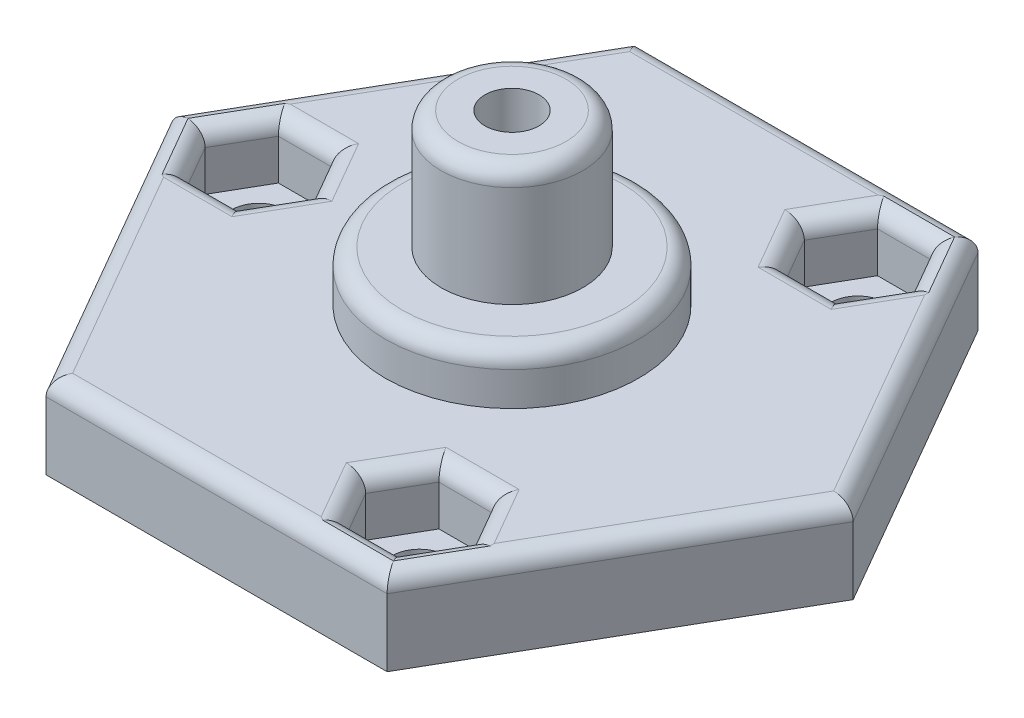
from build123d import *

# Parameters (mm, degrees)
ESQUISSE1_R             = 1.6
BOSS_EXTRU_1_DEPTH      = 5
ENL_V_MAT_EXTRU_1_DEPTH = 3.4
ESQUISSE5_R             = 7.5
BOSS_EXTRU_3_DEPTH      = 3
ESQUISSE4_R             = 4.2
BOSS_EXTRU_2_DEPTH      = 7
CONG_1_R                = 1
ESQUISSE7_R             = 1.6
ENL_V_MAT_EXTRU_2_DEPTH = 31.652623596
ENL_V_MAT_EXTRU_3_DEPTH = 5


with BuildPart() as part:
    # Esquisse1 → Boss.-Extru.1 (new body)
    with BuildSketch(Plane(origin=(0, 0, 0), x_dir=(1, 0, 0), z_dir=(0, 1, 0))):
        Polygon((10.103629711, 17.5), (-10.103629711, 17.5), (-20.207259422, 0), (-10.103629711, -17.5), (10.103629711, -17.5), (20.207259422, 0), align=None)
        with Locations(Location((-15, 0, 0), (0, 0, 270))):
            Circle(ESQUISSE1_R, mode=Mode.SUBTRACT)
        with Locations(Location((7.5, 12.990381057, 0), (0, 0, 270))):
            Circle(ESQUISSE1_R, mode=Mode.SUBTRACT)
        with Locations(Location((7.5, -12.990381057, 0), (0, 0, 270))):
            Circle(ESQUISSE1_R, mode=Mode.SUBTRACT)
    extrude(amount=BOSS_EXTRU_1_DEPTH)

    # Esquisse3 → Enlèv. mat.-Extru.1 (cut)
    with BuildSketch(Plane(origin=(0, 5, 0), x_dir=(1, 0, 0), z_dir=(0, 1, 0))):
        Polygon((-13.41228676, 2.75), (-16.58771324, 2.75), (-18.175426481, 0), (-16.58771324, -2.75), (-13.41228676, -2.75), (-11.824573519, 0), align=None)
        Polygon((9.08771324, 10.240381057), (10.675426481, 12.990381057), (9.08771324, 15.740381057), (5.91228676, 15.740381057), (4.324573519, 12.990381057), (5.91228676, 10.240381057), align=None)
        Polygon((9.08771324, -10.240381057), (5.91228676, -10.240381057), (4.324573519, -12.990381057), (5.91228676, -15.740381057), (9.08771324, -15.740381057), (10.675426481, -12.990381057), align=None)
    extrude(amount=-ENL_V_MAT_EXTRU_1_DEPTH, mode=Mode.SUBTRACT)

    # Esquisse5 → Boss.-Extru.3 (add)
    with BuildSketch(Plane(origin=(0, 5, 0), x_dir=(1, 0, 0), z_dir=(0, 1, 0))):
        with Locations(Location((0, 0, 0), (0, 0, 270))):
            Circle(ESQUISSE5_R)
    extrude(amount=BOSS_EXTRU_3_DEPTH)

    # Esquisse4 → Boss.-Extru.2 (add)
    with BuildSketch(Plane(origin=(0, 8, 0), x_dir=(1, 0, 0), z_dir=(0, 1, 0))):
        with Locations(Location((0, 0, 0), (0, 0, 270))):
            Circle(ESQUISSE4_R)
    extrude(amount=BOSS_EXTRU_2_DEPTH)

    # Congé1
    # the kernel refuses this fillet: 1 mm, written as the material it takes off along each edge
    with BuildSketch(Plane(origin=(-8.853629711, 5, -19.665063509), x_dir=(0, -1, 0), z_dir=(-0.5000000000000002, 0, 0.8660254037844386)), Plane(origin=(21.457259422, 5, 2.165063509), x_dir=(0, -1, 0), z_dir=(-0.5000000000000003, 0, -0.8660254037844386)), Plane(origin=(12.603629711, 5, -17.5), x_dir=(0, -1, 0), z_dir=(-1, 0, 0))) as cong_1_piece_1:
        with BuildLine():
            CenterArc((CONG_1_R, CONG_1_R), CONG_1_R, 180, 90)
            Line((0, CONG_1_R), (0, 0))
            Line((0, 0), (CONG_1_R, 0))
        make_face()
    extrude(amount=25.207259422, mode=Mode.SUBTRACT)
    with BuildSketch(Plane(origin=(-21.457259422, 5, -2.165063509), x_dir=(0.8660254037844386, 0, -0.5000000000000002), z_dir=(0.5000000000000002, 0, 0.8660254037844386)), Plane(origin=(-12.603629711, 5, 17.5), x_dir=(0, 0, -1), z_dir=(1, 0, 0)), Plane(origin=(8.853629711, 5, 19.665063509), x_dir=(-0.8660254037844386, 0, -0.5000000000000001), z_dir=(0.5000000000000001, 0, -0.8660254037844386))) as cong_1_piece_2:
        with BuildLine():
            CenterArc((CONG_1_R, -CONG_1_R), CONG_1_R, 90, 90)
            Line((0, -CONG_1_R), (0, 0))
            Line((0, 0), (CONG_1_R, 0))
        make_face()
    extrude(amount=25.207259422, mode=Mode.SUBTRACT)
    with BuildSketch(Plane(origin=(-10.574573519, 5, 2.165063509), x_dir=(0.866025403784438, 0, -0.500000000000001), z_dir=(-0.500000000000001, 0, -0.8660254037844382))) as cong_1_piece_3_section:
        with BuildLine():
            CenterArc((CONG_1_R, CONG_1_R), CONG_1_R, 180, 90)
            Line((0, CONG_1_R), (0, 0))
            Line((0, 0), (CONG_1_R, 0))
        make_face()
    cong_1_piece_3 = extrude(amount=8.175426481, mode=Mode.PRIVATE)
    cong_1_piece_3 = split(cong_1_piece_3, bisect_by=Plane(origin=(-12.438315605, 4.76272493, -2.75), z_dir=(0, 0, 1)), keep=Keep.TOP, mode=Mode.PRIVATE)
    cong_1_piece_3 = split(cong_1_piece_3, bisect_by=Plane(origin=(-11.337587942, 4.76272493, -0.843483763), z_dir=(-0.8660254037844386, 0, -0.5000000000000002)), keep=Keep.TOP, mode=Mode.PRIVATE)
    add(cong_1_piece_3, mode=Mode.SUBTRACT)
    with BuildSketch(Plane(origin=(-10.91228676, 5, -2.75), x_dir=(0, 0, -1), z_dir=(-1, 0, 0))) as cong_1_piece_4_section:
        with BuildLine():
            CenterArc((CONG_1_R, CONG_1_R), CONG_1_R, 180, 90)
            Line((0, CONG_1_R), (0, 0))
            Line((0, 0), (CONG_1_R, 0))
        make_face()
    cong_1_piece_4 = extrude(amount=8.175426481, mode=Mode.PRIVATE)
    cong_1_piece_4 = split(cong_1_piece_4, bisect_by=Plane(origin=(-13.899272337, 4.76272493, -3.593483763), z_dir=(-0.8660254037844382, 0, 0.500000000000001)), keep=Keep.TOP, mode=Mode.PRIVATE)
    cong_1_piece_4 = split(cong_1_piece_4, bisect_by=Plane(origin=(-16.100727663, 4.76272493, -3.593483763), z_dir=(0.8660254037844394, 0, 0.49999999999999883)), keep=Keep.TOP, mode=Mode.PRIVATE)
    add(cong_1_piece_4, mode=Mode.SUBTRACT)
    with BuildSketch(Plane(origin=(-15.33771324, 5, -4.915063509), x_dir=(-0.8660254037844393, 0, -0.49999999999999883), z_dir=(-0.49999999999999883, 0, 0.8660254037844394))) as cong_1_piece_5_section:
        with BuildLine():
            CenterArc((CONG_1_R, CONG_1_R), CONG_1_R, 180, 90)
            Line((0, CONG_1_R), (0, 0))
            Line((0, 0), (CONG_1_R, 0))
        make_face()
    cong_1_piece_5 = extrude(amount=8.175426481, mode=Mode.PRIVATE)
    cong_1_piece_5 = split(cong_1_piece_5, bisect_by=Plane(origin=(-17.561684395, 4.76272493, -2.75), z_dir=(0, 0, 1)), keep=Keep.TOP, mode=Mode.PRIVATE)
    cong_1_piece_5 = split(cong_1_piece_5, bisect_by=Plane(origin=(-18.662412058, 4.76272493, -0.843483763), z_dir=(0.8660254037844384, 0, -0.5000000000000006)), keep=Keep.TOP, mode=Mode.PRIVATE)
    add(cong_1_piece_5, mode=Mode.SUBTRACT)
    with BuildSketch(Plane(origin=(-19.425426481, 5, -2.165063509), x_dir=(-0.8660254037844384, 0, 0.5000000000000006), z_dir=(0.5000000000000006, 0, 0.8660254037844384))) as cong_1_piece_6_section:
        with BuildLine():
            CenterArc((CONG_1_R, CONG_1_R), CONG_1_R, 180, 90)
            Line((0, CONG_1_R), (0, 0))
            Line((0, 0), (CONG_1_R, 0))
        make_face()
    cong_1_piece_6 = extrude(amount=8.175426481, mode=Mode.PRIVATE)
    cong_1_piece_6 = split(cong_1_piece_6, bisect_by=Plane(origin=(-18.662412058, 4.76272493, 0.843483763), z_dir=(0.8660254037844394, 0, 0.49999999999999883)), keep=Keep.TOP, mode=Mode.PRIVATE)
    cong_1_piece_6 = split(cong_1_piece_6, bisect_by=Plane(origin=(-17.561684395, 4.76272493, 2.75), z_dir=(0, 0, -1)), keep=Keep.TOP, mode=Mode.PRIVATE)
    add(cong_1_piece_6, mode=Mode.SUBTRACT)
    with BuildSketch(Plane(origin=(-19.08771324, 5, 2.75), x_dir=(0, 0, 1), z_dir=(1, 0, 0))) as cong_1_piece_7_section:
        with BuildLine():
            CenterArc((CONG_1_R, CONG_1_R), CONG_1_R, 180, 90)
            Line((0, CONG_1_R), (0, 0))
            Line((0, 0), (CONG_1_R, 0))
        make_face()
    cong_1_piece_7 = extrude(amount=8.175426481, mode=Mode.PRIVATE)
    cong_1_piece_7 = split(cong_1_piece_7, bisect_by=Plane(origin=(-13.899272337, 4.76272493, 3.593483763), z_dir=(-0.8660254037844386, 0, -0.5000000000000002)), keep=Keep.TOP, mode=Mode.PRIVATE)
    cong_1_piece_7 = split(cong_1_piece_7, bisect_by=Plane(origin=(-16.100727663, 4.76272493, 3.593483763), z_dir=(0.8660254037844384, 0, -0.5000000000000006)), keep=Keep.TOP, mode=Mode.PRIVATE)
    add(cong_1_piece_7, mode=Mode.SUBTRACT)
    with BuildSketch(Plane(origin=(-14.66228676, 5, 4.915063509), x_dir=(0.8660254037844387, 0, 0.5000000000000002), z_dir=(0.5000000000000002, 0, -0.8660254037844386))) as cong_1_piece_8_section:
        with BuildLine():
            CenterArc((CONG_1_R, CONG_1_R), CONG_1_R, 180, 90)
            Line((0, CONG_1_R), (0, 0))
            Line((0, 0), (CONG_1_R, 0))
        make_face()
    cong_1_piece_8 = extrude(amount=8.175426481, mode=Mode.PRIVATE)
    cong_1_piece_8 = split(cong_1_piece_8, bisect_by=Plane(origin=(-11.337587942, 4.76272493, 0.843483763), z_dir=(-0.8660254037844382, 0, 0.500000000000001)), keep=Keep.TOP, mode=Mode.PRIVATE)
    cong_1_piece_8 = split(cong_1_piece_8, bisect_by=Plane(origin=(-12.438315605, 4.76272493, 2.75), z_dir=(0, 0, -1)), keep=Keep.TOP, mode=Mode.PRIVATE)
    add(cong_1_piece_8, mode=Mode.SUBTRACT)
    with BuildSketch(Plane(origin=(3.41228676, 5, -10.240381057), x_dir=(0, 0, 1), z_dir=(1, 0, 0))) as cong_1_piece_9_section:
        with BuildLine():
            CenterArc((CONG_1_R, CONG_1_R), CONG_1_R, 180, 90)
            Line((0, CONG_1_R), (0, 0))
            Line((0, 0), (CONG_1_R, 0))
        make_face()
    cong_1_piece_9 = extrude(amount=8.175426481, mode=Mode.PRIVATE)
    cong_1_piece_9 = split(cong_1_piece_9, bisect_by=Plane(origin=(8.600727663, 4.76272493, -9.396897294), z_dir=(-0.8660254037844385, 0, -0.5000000000000003)), keep=Keep.TOP, mode=Mode.PRIVATE)
    cong_1_piece_9 = split(cong_1_piece_9, bisect_by=Plane(origin=(6.399272337, 4.76272493, -9.396897294), z_dir=(0.866025403784439, 0, -0.4999999999999995)), keep=Keep.TOP, mode=Mode.PRIVATE)
    add(cong_1_piece_9, mode=Mode.SUBTRACT)
    with BuildSketch(Plane(origin=(7.83771324, 5, -8.075317547), x_dir=(0.8660254037844385, 0, 0.5000000000000003), z_dir=(0.5000000000000003, 0, -0.8660254037844385))) as cong_1_piece_10_section:
        with BuildLine():
            CenterArc((CONG_1_R, CONG_1_R), CONG_1_R, 180, 90)
            Line((0, CONG_1_R), (0, 0))
            Line((0, 0), (CONG_1_R, 0))
        make_face()
    cong_1_piece_10 = extrude(amount=8.175426481, mode=Mode.PRIVATE)
    cong_1_piece_10 = split(cong_1_piece_10, bisect_by=Plane(origin=(10.061684395, 4.76272493, -10.240381057), z_dir=(0, 0, -1)), keep=Keep.TOP, mode=Mode.PRIVATE)
    cong_1_piece_10 = split(cong_1_piece_10, bisect_by=Plane(origin=(11.162412058, 4.76272493, -12.146897294), z_dir=(-0.8660254037844394, 0, 0.4999999999999987)), keep=Keep.TOP, mode=Mode.PRIVATE)
    add(cong_1_piece_10, mode=Mode.SUBTRACT)
    with BuildSketch(Plane(origin=(11.925426481, 5, -10.825317547), x_dir=(0.8660254037844394, 0, -0.4999999999999988), z_dir=(-0.4999999999999987, 0, -0.8660254037844394))) as cong_1_piece_11_section:
        with BuildLine():
            CenterArc((CONG_1_R, CONG_1_R), CONG_1_R, 180, 90)
            Line((0, CONG_1_R), (0, 0))
            Line((0, 0), (CONG_1_R, 0))
        make_face()
    cong_1_piece_11 = extrude(amount=8.175426481, mode=Mode.PRIVATE)
    cong_1_piece_11 = split(cong_1_piece_11, bisect_by=Plane(origin=(11.162412058, 4.76272493, -13.833864819), z_dir=(-0.8660254037844385, 0, -0.5000000000000003)), keep=Keep.TOP, mode=Mode.PRIVATE)
    cong_1_piece_11 = split(cong_1_piece_11, bisect_by=Plane(origin=(10.061684395, 4.76272493, -15.740381057), z_dir=(0, 0, 1)), keep=Keep.TOP, mode=Mode.PRIVATE)
    add(cong_1_piece_11, mode=Mode.SUBTRACT)
    with BuildSketch(Plane(origin=(11.58771324, 5, -15.740381057), x_dir=(0, 0, -1), z_dir=(-1, 0, 0))) as cong_1_piece_12_section:
        with BuildLine():
            CenterArc((CONG_1_R, CONG_1_R), CONG_1_R, 180, 90)
            Line((0, CONG_1_R), (0, 0))
            Line((0, 0), (CONG_1_R, 0))
        make_face()
    cong_1_piece_12 = extrude(amount=8.175426481, mode=Mode.PRIVATE)
    cong_1_piece_12 = split(cong_1_piece_12, bisect_by=Plane(origin=(8.600727663, 4.76272493, -16.583864819), z_dir=(-0.8660254037844394, 0, 0.4999999999999987)), keep=Keep.TOP, mode=Mode.PRIVATE)
    cong_1_piece_12 = split(cong_1_piece_12, bisect_by=Plane(origin=(6.399272337, 4.76272493, -16.583864819), z_dir=(0.8660254037844387, 0, 0.5)), keep=Keep.TOP, mode=Mode.PRIVATE)
    add(cong_1_piece_12, mode=Mode.SUBTRACT)
    with BuildSketch(Plane(origin=(7.16228676, 5, -17.905444566), x_dir=(-0.8660254037844387, 0, -0.49999999999999994), z_dir=(-0.5, 0, 0.8660254037844387))) as cong_1_piece_13_section:
        with BuildLine():
            CenterArc((CONG_1_R, CONG_1_R), CONG_1_R, 180, 90)
            Line((0, CONG_1_R), (0, 0))
            Line((0, 0), (CONG_1_R, 0))
        make_face()
    cong_1_piece_13 = extrude(amount=8.175426481, mode=Mode.PRIVATE)
    cong_1_piece_13 = split(cong_1_piece_13, bisect_by=Plane(origin=(3.837587942, 4.76272493, -13.833864819), z_dir=(0.866025403784439, 0, -0.4999999999999995)), keep=Keep.TOP, mode=Mode.PRIVATE)
    cong_1_piece_13 = split(cong_1_piece_13, bisect_by=Plane(origin=(4.938315605, 4.76272493, -15.740381057), z_dir=(0, 0, 1)), keep=Keep.TOP, mode=Mode.PRIVATE)
    add(cong_1_piece_13, mode=Mode.SUBTRACT)
    with BuildSketch(Plane(origin=(3.074573519, 5, -15.155444566), x_dir=(-0.866025403784439, 0, 0.4999999999999995), z_dir=(0.4999999999999995, 0, 0.866025403784439))) as cong_1_piece_14_section:
        with BuildLine():
            CenterArc((CONG_1_R, CONG_1_R), CONG_1_R, 180, 90)
            Line((0, CONG_1_R), (0, 0))
            Line((0, 0), (CONG_1_R, 0))
        make_face()
    cong_1_piece_14 = extrude(amount=8.175426481, mode=Mode.PRIVATE)
    cong_1_piece_14 = split(cong_1_piece_14, bisect_by=Plane(origin=(4.938315605, 4.76272493, -10.240381057), z_dir=(0, 0, -1)), keep=Keep.TOP, mode=Mode.PRIVATE)
    cong_1_piece_14 = split(cong_1_piece_14, bisect_by=Plane(origin=(3.837587942, 4.76272493, -12.146897294), z_dir=(0.8660254037844387, 0, 0.5)), keep=Keep.TOP, mode=Mode.PRIVATE)
    add(cong_1_piece_14, mode=Mode.SUBTRACT)
    with BuildSketch(Plane(origin=(11.925426481, 5, 15.155444566), x_dir=(0.8660254037844385, 0, -0.5000000000000003), z_dir=(-0.5000000000000003, 0, -0.8660254037844385))) as cong_1_piece_15_section:
        with BuildLine():
            CenterArc((CONG_1_R, CONG_1_R), CONG_1_R, 180, 90)
            Line((0, CONG_1_R), (0, 0))
            Line((0, 0), (CONG_1_R, 0))
        make_face()
    cong_1_piece_15 = extrude(amount=8.175426481, mode=Mode.PRIVATE)
    cong_1_piece_15 = split(cong_1_piece_15, bisect_by=Plane(origin=(10.061684395, 4.76272493, 10.240381057), z_dir=(0, 0, 1)), keep=Keep.TOP, mode=Mode.PRIVATE)
    cong_1_piece_15 = split(cong_1_piece_15, bisect_by=Plane(origin=(11.162412058, 4.76272493, 12.146897294), z_dir=(-0.8660254037844389, 0, -0.49999999999999956)), keep=Keep.TOP, mode=Mode.PRIVATE)
    add(cong_1_piece_15, mode=Mode.SUBTRACT)
    with BuildSketch(Plane(origin=(11.58771324, 5, 10.240381057), x_dir=(0, 0, -1), z_dir=(-1, 0, 0))) as cong_1_piece_16_section:
        with BuildLine():
            CenterArc((CONG_1_R, CONG_1_R), CONG_1_R, 180, 90)
            Line((0, CONG_1_R), (0, 0))
            Line((0, 0), (CONG_1_R, 0))
        make_face()
    cong_1_piece_16 = extrude(amount=8.175426481, mode=Mode.PRIVATE)
    cong_1_piece_16 = split(cong_1_piece_16, bisect_by=Plane(origin=(8.600727663, 4.76272493, 9.396897294), z_dir=(-0.8660254037844385, 0, 0.5000000000000003)), keep=Keep.TOP, mode=Mode.PRIVATE)
    cong_1_piece_16 = split(cong_1_piece_16, bisect_by=Plane(origin=(6.399272337, 4.76272493, 9.396897294), z_dir=(0.8660254037844389, 0, 0.4999999999999996)), keep=Keep.TOP, mode=Mode.PRIVATE)
    add(cong_1_piece_16, mode=Mode.SUBTRACT)
    with BuildSketch(Plane(origin=(7.16228676, 5, 8.075317547), x_dir=(-0.866025403784439, 0, -0.4999999999999996), z_dir=(-0.4999999999999996, 0, 0.8660254037844389))) as cong_1_piece_17_section:
        with BuildLine():
            CenterArc((CONG_1_R, CONG_1_R), CONG_1_R, 180, 90)
            Line((0, CONG_1_R), (0, 0))
            Line((0, 0), (CONG_1_R, 0))
        make_face()
    cong_1_piece_17 = extrude(amount=8.175426481, mode=Mode.PRIVATE)
    cong_1_piece_17 = split(cong_1_piece_17, bisect_by=Plane(origin=(4.938315605, 4.76272493, 10.240381057), z_dir=(0, 0, 1)), keep=Keep.TOP, mode=Mode.PRIVATE)
    cong_1_piece_17 = split(cong_1_piece_17, bisect_by=Plane(origin=(3.837587942, 4.76272493, 12.146897294), z_dir=(0.8660254037844385, 0, -0.5000000000000003)), keep=Keep.TOP, mode=Mode.PRIVATE)
    add(cong_1_piece_17, mode=Mode.SUBTRACT)
    with BuildSketch(Plane(origin=(3.074573519, 5, 10.825317547), x_dir=(-0.8660254037844385, 0, 0.5000000000000003), z_dir=(0.5000000000000003, 0, 0.8660254037844385))) as cong_1_piece_18_section:
        with BuildLine():
            CenterArc((CONG_1_R, CONG_1_R), CONG_1_R, 180, 90)
            Line((0, CONG_1_R), (0, 0))
            Line((0, 0), (CONG_1_R, 0))
        make_face()
    cong_1_piece_18 = extrude(amount=8.175426481, mode=Mode.PRIVATE)
    cong_1_piece_18 = split(cong_1_piece_18, bisect_by=Plane(origin=(3.837587942, 4.76272493, 13.833864819), z_dir=(0.8660254037844389, 0, 0.4999999999999996)), keep=Keep.TOP, mode=Mode.PRIVATE)
    cong_1_piece_18 = split(cong_1_piece_18, bisect_by=Plane(origin=(4.938315605, 4.76272493, 15.740381057), z_dir=(0, 0, -1)), keep=Keep.TOP, mode=Mode.PRIVATE)
    add(cong_1_piece_18, mode=Mode.SUBTRACT)
    with BuildSketch(Plane(origin=(3.41228676, 5, 15.740381057), x_dir=(0, 0, 1), z_dir=(1, 0, 0))) as cong_1_piece_19_section:
        with BuildLine():
            CenterArc((CONG_1_R, CONG_1_R), CONG_1_R, 180, 90)
            Line((0, CONG_1_R), (0, 0))
            Line((0, 0), (CONG_1_R, 0))
        make_face()
    cong_1_piece_19 = extrude(amount=8.175426481, mode=Mode.PRIVATE)
    cong_1_piece_19 = split(cong_1_piece_19, bisect_by=Plane(origin=(8.600727663, 4.76272493, 16.583864819), z_dir=(-0.8660254037844389, 0, -0.49999999999999956)), keep=Keep.TOP, mode=Mode.PRIVATE)
    cong_1_piece_19 = split(cong_1_piece_19, bisect_by=Plane(origin=(6.399272337, 4.76272493, 16.583864819), z_dir=(0.8660254037844385, 0, -0.5000000000000003)), keep=Keep.TOP, mode=Mode.PRIVATE)
    add(cong_1_piece_19, mode=Mode.SUBTRACT)
    with BuildSketch(Plane(origin=(7.83771324, 5, 17.905444566), x_dir=(0.866025403784439, 0, 0.4999999999999996), z_dir=(0.49999999999999956, 0, -0.8660254037844389))) as cong_1_piece_20_section:
        with BuildLine():
            CenterArc((CONG_1_R, CONG_1_R), CONG_1_R, 180, 90)
            Line((0, CONG_1_R), (0, 0))
            Line((0, 0), (CONG_1_R, 0))
        make_face()
    cong_1_piece_20 = extrude(amount=8.175426481, mode=Mode.PRIVATE)
    cong_1_piece_20 = split(cong_1_piece_20, bisect_by=Plane(origin=(11.162412058, 4.76272493, 13.833864819), z_dir=(-0.8660254037844385, 0, 0.5000000000000003)), keep=Keep.TOP, mode=Mode.PRIVATE)
    cong_1_piece_20 = split(cong_1_piece_20, bisect_by=Plane(origin=(10.061684395, 4.76272493, 15.740381057), z_dir=(0, 0, -1)), keep=Keep.TOP, mode=Mode.PRIVATE)
    add(cong_1_piece_20, mode=Mode.SUBTRACT)
    with BuildSketch(Plane(origin=(0, 8, 0), x_dir=(0, 0, 1), z_dir=(-1, 0, 0))) as cong_1_piece_21:
        with BuildLine():
            CenterArc((7.5 - CONG_1_R, -CONG_1_R), CONG_1_R, 0, 90)
            Line((7.5 - CONG_1_R, 0), (7.5, 0))
            Line((7.5, 0), (7.5, -CONG_1_R))
        make_face()
    revolve(axis=Axis((0, 8, 0), (0, 1, 0)), mode=Mode.SUBTRACT)
    with BuildSketch(Plane(origin=(0, 15, 0), x_dir=(0, 0, 1), z_dir=(-1, 0, 0))) as cong_1_piece_22:
        with BuildLine():
            CenterArc((4.2 - CONG_1_R, -CONG_1_R), CONG_1_R, 0, 90)
            Line((4.2 - CONG_1_R, 0), (4.2, 0))
            Line((4.2, 0), (4.2, -CONG_1_R))
        make_face()
    revolve(axis=Axis((0, 15, 0), (0, 1, 0)), mode=Mode.SUBTRACT)
    with BuildSketch(Plane(origin=(-10.574573519, 5, 2.165063509), x_dir=(0.866025403784438, 0, -0.500000000000001), z_dir=(-0.500000000000001, 0, -0.8660254037844382))) as cong_1_piece_23a_section:
        with BuildLine():
            CenterArc((CONG_1_R, CONG_1_R), CONG_1_R, 180, 90)
            Line((0, CONG_1_R), (0, 0))
            Line((0, 0), (CONG_1_R, 0))
        make_face()
    cong_1_piece_23a = extrude(amount=8.175426481, mode=Mode.PRIVATE)
    cong_1_piece_23a = split(cong_1_piece_23a, bisect_by=Plane(origin=(-12.017550036, 4.77963069, 0.334245131), z_dir=(0.8660254037844386, 0, 0.5000000000000002)), keep=Keep.TOP, mode=Mode.PRIVATE)
    with BuildSketch(Plane(origin=(-14.66228676, 5, 4.915063509), x_dir=(0.8660254037844387, 0, 0.5000000000000002), z_dir=(0.5000000000000002, 0, -0.8660254037844386))) as cong_1_piece_23b_section:
        with BuildLine():
            CenterArc((CONG_1_R, CONG_1_R), CONG_1_R, 180, 90)
            Line((0, CONG_1_R), (0, 0))
            Line((0, 0), (CONG_1_R, 0))
        make_face()
    cong_1_piece_23b = extrude(amount=8.175426481, mode=Mode.PRIVATE)
    cong_1_piece_23b = split(cong_1_piece_23b, bisect_by=Plane(origin=(-12.017550036, 4.77963069, -0.334245131), z_dir=(0.8660254037844382, 0, -0.500000000000001)), keep=Keep.TOP, mode=Mode.PRIVATE)
    cong_1_piece_23 = cong_1_piece_23a & cong_1_piece_23b
    add(cong_1_piece_23, mode=Mode.SUBTRACT)
    with BuildSketch(Plane(origin=(-10.91228676, 5, -2.75), x_dir=(0, 0, -1), z_dir=(-1, 0, 0))) as cong_1_piece_24a_section:
        with BuildLine():
            CenterArc((CONG_1_R, CONG_1_R), CONG_1_R, 180, 90)
            Line((0, CONG_1_R), (0, 0))
            Line((0, 0), (CONG_1_R, 0))
        make_face()
    cong_1_piece_24a = extrude(amount=8.175426481, mode=Mode.PRIVATE)
    cong_1_piece_24a = split(cong_1_piece_24a, bisect_by=Plane(origin=(-13.219310243, 4.77963069, -2.415754869), z_dir=(0.8660254037844382, 0, -0.500000000000001)), keep=Keep.TOP, mode=Mode.PRIVATE)
    with BuildSketch(Plane(origin=(-10.574573519, 5, 2.165063509), x_dir=(0.866025403784438, 0, -0.500000000000001), z_dir=(-0.500000000000001, 0, -0.8660254037844382))) as cong_1_piece_24b_section:
        with BuildLine():
            CenterArc((CONG_1_R, CONG_1_R), CONG_1_R, 180, 90)
            Line((0, CONG_1_R), (0, 0))
            Line((0, 0), (CONG_1_R, 0))
        make_face()
    cong_1_piece_24b = extrude(amount=8.175426481, mode=Mode.PRIVATE)
    cong_1_piece_24b = split(cong_1_piece_24b, bisect_by=Plane(origin=(-13.798239793, 4.77963069, -2.75), z_dir=(0, 0, -1)), keep=Keep.TOP, mode=Mode.PRIVATE)
    cong_1_piece_24 = cong_1_piece_24a & cong_1_piece_24b
    add(cong_1_piece_24, mode=Mode.SUBTRACT)
    with BuildSketch(Plane(origin=(-10.91228676, 5, -2.75), x_dir=(0, 0, -1), z_dir=(-1, 0, 0))) as cong_1_piece_25a_section:
        with BuildLine():
            CenterArc((CONG_1_R, CONG_1_R), CONG_1_R, 180, 90)
            Line((0, CONG_1_R), (0, 0))
            Line((0, 0), (CONG_1_R, 0))
        make_face()
    cong_1_piece_25a = extrude(amount=8.175426481, mode=Mode.PRIVATE)
    cong_1_piece_25a = split(cong_1_piece_25a, bisect_by=Plane(origin=(-16.780689757, 4.77963069, -2.415754869), z_dir=(-0.8660254037844394, 0, -0.49999999999999883)), keep=Keep.TOP, mode=Mode.PRIVATE)
    with BuildSketch(Plane(origin=(-15.33771324, 5, -4.915063509), x_dir=(-0.8660254037844393, 0, -0.49999999999999883), z_dir=(-0.49999999999999883, 0, 0.8660254037844394))) as cong_1_piece_25b_section:
        with BuildLine():
            CenterArc((CONG_1_R, CONG_1_R), CONG_1_R, 180, 90)
            Line((0, CONG_1_R), (0, 0))
            Line((0, 0), (CONG_1_R, 0))
        make_face()
    cong_1_piece_25b = extrude(amount=8.175426481, mode=Mode.PRIVATE)
    cong_1_piece_25b = split(cong_1_piece_25b, bisect_by=Plane(origin=(-16.201760207, 4.77963069, -2.75), z_dir=(0, 0, -1)), keep=Keep.TOP, mode=Mode.PRIVATE)
    cong_1_piece_25 = cong_1_piece_25a & cong_1_piece_25b
    add(cong_1_piece_25, mode=Mode.SUBTRACT)
    with BuildSketch(Plane(origin=(-15.33771324, 5, -4.915063509), x_dir=(-0.8660254037844393, 0, -0.49999999999999883), z_dir=(-0.49999999999999883, 0, 0.8660254037844394))) as cong_1_piece_26a_section:
        with BuildLine():
            CenterArc((CONG_1_R, CONG_1_R), CONG_1_R, 180, 90)
            Line((0, CONG_1_R), (0, 0))
            Line((0, 0), (CONG_1_R, 0))
        make_face()
    cong_1_piece_26a = extrude(amount=8.175426481, mode=Mode.PRIVATE)
    cong_1_piece_26a = split(cong_1_piece_26a, bisect_by=Plane(origin=(-17.982449964, 4.77963069, 0.334245131), z_dir=(-0.8660254037844384, 0, 0.5000000000000006)), keep=Keep.TOP, mode=Mode.PRIVATE)
    with BuildSketch(Plane(origin=(-19.425426481, 5, -2.165063509), x_dir=(-0.8660254037844384, 0, 0.5000000000000006), z_dir=(0.5000000000000006, 0, 0.8660254037844384))) as cong_1_piece_26b_section:
        with BuildLine():
            CenterArc((CONG_1_R, CONG_1_R), CONG_1_R, 180, 90)
            Line((0, CONG_1_R), (0, 0))
            Line((0, 0), (CONG_1_R, 0))
        make_face()
    cong_1_piece_26b = extrude(amount=8.175426481, mode=Mode.PRIVATE)
    cong_1_piece_26b = split(cong_1_piece_26b, bisect_by=Plane(origin=(-17.982449964, 4.77963069, -0.334245131), z_dir=(-0.8660254037844394, 0, -0.49999999999999883)), keep=Keep.TOP, mode=Mode.PRIVATE)
    cong_1_piece_26 = cong_1_piece_26a & cong_1_piece_26b
    add(cong_1_piece_26, mode=Mode.SUBTRACT)
    with BuildSketch(Plane(origin=(-19.425426481, 5, -2.165063509), x_dir=(-0.8660254037844384, 0, 0.5000000000000006), z_dir=(0.5000000000000006, 0, 0.8660254037844384))) as cong_1_piece_27a_section:
        with BuildLine():
            CenterArc((CONG_1_R, CONG_1_R), CONG_1_R, 180, 90)
            Line((0, CONG_1_R), (0, 0))
            Line((0, 0), (CONG_1_R, 0))
        make_face()
    cong_1_piece_27a = extrude(amount=8.175426481, mode=Mode.PRIVATE)
    cong_1_piece_27a = split(cong_1_piece_27a, bisect_by=Plane(origin=(-16.201760207, 4.77963069, 2.75), z_dir=(0, 0, 1)), keep=Keep.TOP, mode=Mode.PRIVATE)
    with BuildSketch(Plane(origin=(-19.08771324, 5, 2.75), x_dir=(0, 0, 1), z_dir=(1, 0, 0))) as cong_1_piece_27b_section:
        with BuildLine():
            CenterArc((CONG_1_R, CONG_1_R), CONG_1_R, 180, 90)
            Line((0, CONG_1_R), (0, 0))
            Line((0, 0), (CONG_1_R, 0))
        make_face()
    cong_1_piece_27b = extrude(amount=8.175426481, mode=Mode.PRIVATE)
    cong_1_piece_27b = split(cong_1_piece_27b, bisect_by=Plane(origin=(-16.780689757, 4.77963069, 2.415754869), z_dir=(-0.8660254037844384, 0, 0.5000000000000006)), keep=Keep.TOP, mode=Mode.PRIVATE)
    cong_1_piece_27 = cong_1_piece_27a & cong_1_piece_27b
    add(cong_1_piece_27, mode=Mode.SUBTRACT)
    with BuildSketch(Plane(origin=(-14.66228676, 5, 4.915063509), x_dir=(0.8660254037844387, 0, 0.5000000000000002), z_dir=(0.5000000000000002, 0, -0.8660254037844386))) as cong_1_piece_28a_section:
        with BuildLine():
            CenterArc((CONG_1_R, CONG_1_R), CONG_1_R, 180, 90)
            Line((0, CONG_1_R), (0, 0))
            Line((0, 0), (CONG_1_R, 0))
        make_face()
    cong_1_piece_28a = extrude(amount=8.175426481, mode=Mode.PRIVATE)
    cong_1_piece_28a = split(cong_1_piece_28a, bisect_by=Plane(origin=(-13.798239793, 4.77963069, 2.75), z_dir=(0, 0, 1)), keep=Keep.TOP, mode=Mode.PRIVATE)
    with BuildSketch(Plane(origin=(-19.08771324, 5, 2.75), x_dir=(0, 0, 1), z_dir=(1, 0, 0))) as cong_1_piece_28b_section:
        with BuildLine():
            CenterArc((CONG_1_R, CONG_1_R), CONG_1_R, 180, 90)
            Line((0, CONG_1_R), (0, 0))
            Line((0, 0), (CONG_1_R, 0))
        make_face()
    cong_1_piece_28b = extrude(amount=8.175426481, mode=Mode.PRIVATE)
    cong_1_piece_28b = split(cong_1_piece_28b, bisect_by=Plane(origin=(-13.219310243, 4.77963069, 2.415754869), z_dir=(0.8660254037844386, 0, 0.5000000000000002)), keep=Keep.TOP, mode=Mode.PRIVATE)
    cong_1_piece_28 = cong_1_piece_28a & cong_1_piece_28b
    add(cong_1_piece_28, mode=Mode.SUBTRACT)
    with BuildSketch(Plane(origin=(3.41228676, 5, -10.240381057), x_dir=(0, 0, 1), z_dir=(1, 0, 0))) as cong_1_piece_29a_section:
        with BuildLine():
            CenterArc((CONG_1_R, CONG_1_R), CONG_1_R, 180, 90)
            Line((0, CONG_1_R), (0, 0))
            Line((0, 0), (CONG_1_R, 0))
        make_face()
    cong_1_piece_29a = extrude(amount=8.175426481, mode=Mode.PRIVATE)
    cong_1_piece_29a = split(cong_1_piece_29a, bisect_by=Plane(origin=(5.719310243, 4.77963069, -10.574626188), z_dir=(-0.866025403784439, 0, 0.4999999999999995)), keep=Keep.TOP, mode=Mode.PRIVATE)
    with BuildSketch(Plane(origin=(3.074573519, 5, -15.155444566), x_dir=(-0.866025403784439, 0, 0.4999999999999995), z_dir=(0.4999999999999995, 0, 0.866025403784439))) as cong_1_piece_29b_section:
        with BuildLine():
            CenterArc((CONG_1_R, CONG_1_R), CONG_1_R, 180, 90)
            Line((0, CONG_1_R), (0, 0))
            Line((0, 0), (CONG_1_R, 0))
        make_face()
    cong_1_piece_29b = extrude(amount=8.175426481, mode=Mode.PRIVATE)
    cong_1_piece_29b = split(cong_1_piece_29b, bisect_by=Plane(origin=(6.298239793, 4.77963069, -10.240381057), z_dir=(0, 0, 1)), keep=Keep.TOP, mode=Mode.PRIVATE)
    cong_1_piece_29 = cong_1_piece_29a & cong_1_piece_29b
    add(cong_1_piece_29, mode=Mode.SUBTRACT)
    with BuildSketch(Plane(origin=(7.83771324, 5, -8.075317547), x_dir=(0.8660254037844385, 0, 0.5000000000000003), z_dir=(0.5000000000000003, 0, -0.8660254037844385))) as cong_1_piece_30a_section:
        with BuildLine():
            CenterArc((CONG_1_R, CONG_1_R), CONG_1_R, 180, 90)
            Line((0, CONG_1_R), (0, 0))
            Line((0, 0), (CONG_1_R, 0))
        make_face()
    cong_1_piece_30a = extrude(amount=8.175426481, mode=Mode.PRIVATE)
    cong_1_piece_30a = split(cong_1_piece_30a, bisect_by=Plane(origin=(8.701760207, 4.77963069, -10.240381057), z_dir=(0, 0, 1)), keep=Keep.TOP, mode=Mode.PRIVATE)
    with BuildSketch(Plane(origin=(3.41228676, 5, -10.240381057), x_dir=(0, 0, 1), z_dir=(1, 0, 0))) as cong_1_piece_30b_section:
        with BuildLine():
            CenterArc((CONG_1_R, CONG_1_R), CONG_1_R, 180, 90)
            Line((0, CONG_1_R), (0, 0))
            Line((0, 0), (CONG_1_R, 0))
        make_face()
    cong_1_piece_30b = extrude(amount=8.175426481, mode=Mode.PRIVATE)
    cong_1_piece_30b = split(cong_1_piece_30b, bisect_by=Plane(origin=(9.280689757, 4.77963069, -10.574626188), z_dir=(0.8660254037844385, 0, 0.5000000000000003)), keep=Keep.TOP, mode=Mode.PRIVATE)
    cong_1_piece_30 = cong_1_piece_30a & cong_1_piece_30b
    add(cong_1_piece_30, mode=Mode.SUBTRACT)
    with BuildSketch(Plane(origin=(7.83771324, 5, -8.075317547), x_dir=(0.8660254037844385, 0, 0.5000000000000003), z_dir=(0.5000000000000003, 0, -0.8660254037844385))) as cong_1_piece_31a_section:
        with BuildLine():
            CenterArc((CONG_1_R, CONG_1_R), CONG_1_R, 180, 90)
            Line((0, CONG_1_R), (0, 0))
            Line((0, 0), (CONG_1_R, 0))
        make_face()
    cong_1_piece_31a = extrude(amount=8.175426481, mode=Mode.PRIVATE)
    cong_1_piece_31a = split(cong_1_piece_31a, bisect_by=Plane(origin=(10.482449964, 4.77963069, -13.324626188), z_dir=(0.8660254037844394, 0, -0.4999999999999987)), keep=Keep.TOP, mode=Mode.PRIVATE)
    with BuildSketch(Plane(origin=(11.925426481, 5, -10.825317547), x_dir=(0.8660254037844394, 0, -0.4999999999999988), z_dir=(-0.4999999999999987, 0, -0.8660254037844394))) as cong_1_piece_31b_section:
        with BuildLine():
            CenterArc((CONG_1_R, CONG_1_R), CONG_1_R, 180, 90)
            Line((0, CONG_1_R), (0, 0))
            Line((0, 0), (CONG_1_R, 0))
        make_face()
    cong_1_piece_31b = extrude(amount=8.175426481, mode=Mode.PRIVATE)
    cong_1_piece_31b = split(cong_1_piece_31b, bisect_by=Plane(origin=(10.482449964, 4.77963069, -12.656135925), z_dir=(0.8660254037844385, 0, 0.5000000000000003)), keep=Keep.TOP, mode=Mode.PRIVATE)
    cong_1_piece_31 = cong_1_piece_31a & cong_1_piece_31b
    add(cong_1_piece_31, mode=Mode.SUBTRACT)
    with BuildSketch(Plane(origin=(11.925426481, 5, -10.825317547), x_dir=(0.8660254037844394, 0, -0.4999999999999988), z_dir=(-0.4999999999999987, 0, -0.8660254037844394))) as cong_1_piece_32a_section:
        with BuildLine():
            CenterArc((CONG_1_R, CONG_1_R), CONG_1_R, 180, 90)
            Line((0, CONG_1_R), (0, 0))
            Line((0, 0), (CONG_1_R, 0))
        make_face()
    cong_1_piece_32a = extrude(amount=8.175426481, mode=Mode.PRIVATE)
    cong_1_piece_32a = split(cong_1_piece_32a, bisect_by=Plane(origin=(8.701760207, 4.77963069, -15.740381057), z_dir=(0, 0, -1)), keep=Keep.TOP, mode=Mode.PRIVATE)
    with BuildSketch(Plane(origin=(11.58771324, 5, -15.740381057), x_dir=(0, 0, -1), z_dir=(-1, 0, 0))) as cong_1_piece_32b_section:
        with BuildLine():
            CenterArc((CONG_1_R, CONG_1_R), CONG_1_R, 180, 90)
            Line((0, CONG_1_R), (0, 0))
            Line((0, 0), (CONG_1_R, 0))
        make_face()
    cong_1_piece_32b = extrude(amount=8.175426481, mode=Mode.PRIVATE)
    cong_1_piece_32b = split(cong_1_piece_32b, bisect_by=Plane(origin=(9.280689757, 4.77963069, -15.406135925), z_dir=(0.8660254037844394, 0, -0.4999999999999987)), keep=Keep.TOP, mode=Mode.PRIVATE)
    cong_1_piece_32 = cong_1_piece_32a & cong_1_piece_32b
    add(cong_1_piece_32, mode=Mode.SUBTRACT)
    with BuildSketch(Plane(origin=(11.58771324, 5, -15.740381057), x_dir=(0, 0, -1), z_dir=(-1, 0, 0))) as cong_1_piece_33a_section:
        with BuildLine():
            CenterArc((CONG_1_R, CONG_1_R), CONG_1_R, 180, 90)
            Line((0, CONG_1_R), (0, 0))
            Line((0, 0), (CONG_1_R, 0))
        make_face()
    cong_1_piece_33a = extrude(amount=8.175426481, mode=Mode.PRIVATE)
    cong_1_piece_33a = split(cong_1_piece_33a, bisect_by=Plane(origin=(5.719310243, 4.77963069, -15.406135925), z_dir=(-0.8660254037844387, 0, -0.5)), keep=Keep.TOP, mode=Mode.PRIVATE)
    with BuildSketch(Plane(origin=(7.16228676, 5, -17.905444566), x_dir=(-0.8660254037844387, 0, -0.49999999999999994), z_dir=(-0.5, 0, 0.8660254037844387))) as cong_1_piece_33b_section:
        with BuildLine():
            CenterArc((CONG_1_R, CONG_1_R), CONG_1_R, 180, 90)
            Line((0, CONG_1_R), (0, 0))
            Line((0, 0), (CONG_1_R, 0))
        make_face()
    cong_1_piece_33b = extrude(amount=8.175426481, mode=Mode.PRIVATE)
    cong_1_piece_33b = split(cong_1_piece_33b, bisect_by=Plane(origin=(6.298239793, 4.77963069, -15.740381057), z_dir=(0, 0, -1)), keep=Keep.TOP, mode=Mode.PRIVATE)
    cong_1_piece_33 = cong_1_piece_33a & cong_1_piece_33b
    add(cong_1_piece_33, mode=Mode.SUBTRACT)
    with BuildSketch(Plane(origin=(3.074573519, 5, -15.155444566), x_dir=(-0.866025403784439, 0, 0.4999999999999995), z_dir=(0.4999999999999995, 0, 0.866025403784439))) as cong_1_piece_34a_section:
        with BuildLine():
            CenterArc((CONG_1_R, CONG_1_R), CONG_1_R, 180, 90)
            Line((0, CONG_1_R), (0, 0))
            Line((0, 0), (CONG_1_R, 0))
        make_face()
    cong_1_piece_34a = extrude(amount=8.175426481, mode=Mode.PRIVATE)
    cong_1_piece_34a = split(cong_1_piece_34a, bisect_by=Plane(origin=(4.517550036, 4.77963069, -13.324626188), z_dir=(-0.8660254037844387, 0, -0.5)), keep=Keep.TOP, mode=Mode.PRIVATE)
    with BuildSketch(Plane(origin=(7.16228676, 5, -17.905444566), x_dir=(-0.8660254037844387, 0, -0.49999999999999994), z_dir=(-0.5, 0, 0.8660254037844387))) as cong_1_piece_34b_section:
        with BuildLine():
            CenterArc((CONG_1_R, CONG_1_R), CONG_1_R, 180, 90)
            Line((0, CONG_1_R), (0, 0))
            Line((0, 0), (CONG_1_R, 0))
        make_face()
    cong_1_piece_34b = extrude(amount=8.175426481, mode=Mode.PRIVATE)
    cong_1_piece_34b = split(cong_1_piece_34b, bisect_by=Plane(origin=(4.517550036, 4.77963069, -12.656135925), z_dir=(-0.866025403784439, 0, 0.4999999999999995)), keep=Keep.TOP, mode=Mode.PRIVATE)
    cong_1_piece_34 = cong_1_piece_34a & cong_1_piece_34b
    add(cong_1_piece_34, mode=Mode.SUBTRACT)
    with BuildSketch(Plane(origin=(11.925426481, 5, 15.155444566), x_dir=(0.8660254037844385, 0, -0.5000000000000003), z_dir=(-0.5000000000000003, 0, -0.8660254037844385))) as cong_1_piece_35a_section:
        with BuildLine():
            CenterArc((CONG_1_R, CONG_1_R), CONG_1_R, 180, 90)
            Line((0, CONG_1_R), (0, 0))
            Line((0, 0), (CONG_1_R, 0))
        make_face()
    cong_1_piece_35a = extrude(amount=8.175426481, mode=Mode.PRIVATE)
    cong_1_piece_35a = split(cong_1_piece_35a, bisect_by=Plane(origin=(10.482449964, 4.77963069, 13.324626188), z_dir=(0.8660254037844389, 0, 0.49999999999999956)), keep=Keep.TOP, mode=Mode.PRIVATE)
    with BuildSketch(Plane(origin=(7.83771324, 5, 17.905444566), x_dir=(0.866025403784439, 0, 0.4999999999999996), z_dir=(0.49999999999999956, 0, -0.8660254037844389))) as cong_1_piece_35b_section:
        with BuildLine():
            CenterArc((CONG_1_R, CONG_1_R), CONG_1_R, 180, 90)
            Line((0, CONG_1_R), (0, 0))
            Line((0, 0), (CONG_1_R, 0))
        make_face()
    cong_1_piece_35b = extrude(amount=8.175426481, mode=Mode.PRIVATE)
    cong_1_piece_35b = split(cong_1_piece_35b, bisect_by=Plane(origin=(10.482449964, 4.77963069, 12.656135925), z_dir=(0.8660254037844385, 0, -0.5000000000000003)), keep=Keep.TOP, mode=Mode.PRIVATE)
    cong_1_piece_35 = cong_1_piece_35a & cong_1_piece_35b
    add(cong_1_piece_35, mode=Mode.SUBTRACT)
    with BuildSketch(Plane(origin=(11.58771324, 5, 10.240381057), x_dir=(0, 0, -1), z_dir=(-1, 0, 0))) as cong_1_piece_36a_section:
        with BuildLine():
            CenterArc((CONG_1_R, CONG_1_R), CONG_1_R, 180, 90)
            Line((0, CONG_1_R), (0, 0))
            Line((0, 0), (CONG_1_R, 0))
        make_face()
    cong_1_piece_36a = extrude(amount=8.175426481, mode=Mode.PRIVATE)
    cong_1_piece_36a = split(cong_1_piece_36a, bisect_by=Plane(origin=(9.280689757, 4.77963069, 10.574626188), z_dir=(0.8660254037844385, 0, -0.5000000000000003)), keep=Keep.TOP, mode=Mode.PRIVATE)
    with BuildSketch(Plane(origin=(11.925426481, 5, 15.155444566), x_dir=(0.8660254037844385, 0, -0.5000000000000003), z_dir=(-0.5000000000000003, 0, -0.8660254037844385))) as cong_1_piece_36b_section:
        with BuildLine():
            CenterArc((CONG_1_R, CONG_1_R), CONG_1_R, 180, 90)
            Line((0, CONG_1_R), (0, 0))
            Line((0, 0), (CONG_1_R, 0))
        make_face()
    cong_1_piece_36b = extrude(amount=8.175426481, mode=Mode.PRIVATE)
    cong_1_piece_36b = split(cong_1_piece_36b, bisect_by=Plane(origin=(8.701760207, 4.77963069, 10.240381057), z_dir=(0, 0, -1)), keep=Keep.TOP, mode=Mode.PRIVATE)
    cong_1_piece_36 = cong_1_piece_36a & cong_1_piece_36b
    add(cong_1_piece_36, mode=Mode.SUBTRACT)
    with BuildSketch(Plane(origin=(11.58771324, 5, 10.240381057), x_dir=(0, 0, -1), z_dir=(-1, 0, 0))) as cong_1_piece_37a_section:
        with BuildLine():
            CenterArc((CONG_1_R, CONG_1_R), CONG_1_R, 180, 90)
            Line((0, CONG_1_R), (0, 0))
            Line((0, 0), (CONG_1_R, 0))
        make_face()
    cong_1_piece_37a = extrude(amount=8.175426481, mode=Mode.PRIVATE)
    cong_1_piece_37a = split(cong_1_piece_37a, bisect_by=Plane(origin=(5.719310243, 4.77963069, 10.574626188), z_dir=(-0.8660254037844389, 0, -0.4999999999999996)), keep=Keep.TOP, mode=Mode.PRIVATE)
    with BuildSketch(Plane(origin=(7.16228676, 5, 8.075317547), x_dir=(-0.866025403784439, 0, -0.4999999999999996), z_dir=(-0.4999999999999996, 0, 0.8660254037844389))) as cong_1_piece_37b_section:
        with BuildLine():
            CenterArc((CONG_1_R, CONG_1_R), CONG_1_R, 180, 90)
            Line((0, CONG_1_R), (0, 0))
            Line((0, 0), (CONG_1_R, 0))
        make_face()
    cong_1_piece_37b = extrude(amount=8.175426481, mode=Mode.PRIVATE)
    cong_1_piece_37b = split(cong_1_piece_37b, bisect_by=Plane(origin=(6.298239793, 4.77963069, 10.240381057), z_dir=(0, 0, -1)), keep=Keep.TOP, mode=Mode.PRIVATE)
    cong_1_piece_37 = cong_1_piece_37a & cong_1_piece_37b
    add(cong_1_piece_37, mode=Mode.SUBTRACT)
    with BuildSketch(Plane(origin=(7.16228676, 5, 8.075317547), x_dir=(-0.866025403784439, 0, -0.4999999999999996), z_dir=(-0.4999999999999996, 0, 0.8660254037844389))) as cong_1_piece_38a_section:
        with BuildLine():
            CenterArc((CONG_1_R, CONG_1_R), CONG_1_R, 180, 90)
            Line((0, CONG_1_R), (0, 0))
            Line((0, 0), (CONG_1_R, 0))
        make_face()
    cong_1_piece_38a = extrude(amount=8.175426481, mode=Mode.PRIVATE)
    cong_1_piece_38a = split(cong_1_piece_38a, bisect_by=Plane(origin=(4.517550036, 4.77963069, 13.324626188), z_dir=(-0.8660254037844385, 0, 0.5000000000000003)), keep=Keep.TOP, mode=Mode.PRIVATE)
    with BuildSketch(Plane(origin=(3.074573519, 5, 10.825317547), x_dir=(-0.8660254037844385, 0, 0.5000000000000003), z_dir=(0.5000000000000003, 0, 0.8660254037844385))) as cong_1_piece_38b_section:
        with BuildLine():
            CenterArc((CONG_1_R, CONG_1_R), CONG_1_R, 180, 90)
            Line((0, CONG_1_R), (0, 0))
            Line((0, 0), (CONG_1_R, 0))
        make_face()
    cong_1_piece_38b = extrude(amount=8.175426481, mode=Mode.PRIVATE)
    cong_1_piece_38b = split(cong_1_piece_38b, bisect_by=Plane(origin=(4.517550036, 4.77963069, 12.656135925), z_dir=(-0.8660254037844389, 0, -0.4999999999999996)), keep=Keep.TOP, mode=Mode.PRIVATE)
    cong_1_piece_38 = cong_1_piece_38a & cong_1_piece_38b
    add(cong_1_piece_38, mode=Mode.SUBTRACT)
    with BuildSketch(Plane(origin=(3.074573519, 5, 10.825317547), x_dir=(-0.8660254037844385, 0, 0.5000000000000003), z_dir=(0.5000000000000003, 0, 0.8660254037844385))) as cong_1_piece_39a_section:
        with BuildLine():
            CenterArc((CONG_1_R, CONG_1_R), CONG_1_R, 180, 90)
            Line((0, CONG_1_R), (0, 0))
            Line((0, 0), (CONG_1_R, 0))
        make_face()
    cong_1_piece_39a = extrude(amount=8.175426481, mode=Mode.PRIVATE)
    cong_1_piece_39a = split(cong_1_piece_39a, bisect_by=Plane(origin=(6.298239793, 4.77963069, 15.740381057), z_dir=(0, 0, 1)), keep=Keep.TOP, mode=Mode.PRIVATE)
    with BuildSketch(Plane(origin=(3.41228676, 5, 15.740381057), x_dir=(0, 0, 1), z_dir=(1, 0, 0))) as cong_1_piece_39b_section:
        with BuildLine():
            CenterArc((CONG_1_R, CONG_1_R), CONG_1_R, 180, 90)
            Line((0, CONG_1_R), (0, 0))
            Line((0, 0), (CONG_1_R, 0))
        make_face()
    cong_1_piece_39b = extrude(amount=8.175426481, mode=Mode.PRIVATE)
    cong_1_piece_39b = split(cong_1_piece_39b, bisect_by=Plane(origin=(5.719310243, 4.77963069, 15.406135925), z_dir=(-0.8660254037844385, 0, 0.5000000000000003)), keep=Keep.TOP, mode=Mode.PRIVATE)
    cong_1_piece_39 = cong_1_piece_39a & cong_1_piece_39b
    add(cong_1_piece_39, mode=Mode.SUBTRACT)
    with BuildSketch(Plane(origin=(7.83771324, 5, 17.905444566), x_dir=(0.866025403784439, 0, 0.4999999999999996), z_dir=(0.49999999999999956, 0, -0.8660254037844389))) as cong_1_piece_40a_section:
        with BuildLine():
            CenterArc((CONG_1_R, CONG_1_R), CONG_1_R, 180, 90)
            Line((0, CONG_1_R), (0, 0))
            Line((0, 0), (CONG_1_R, 0))
        make_face()
    cong_1_piece_40a = extrude(amount=8.175426481, mode=Mode.PRIVATE)
    cong_1_piece_40a = split(cong_1_piece_40a, bisect_by=Plane(origin=(8.701760207, 4.77963069, 15.740381057), z_dir=(0, 0, 1)), keep=Keep.TOP, mode=Mode.PRIVATE)
    with BuildSketch(Plane(origin=(3.41228676, 5, 15.740381057), x_dir=(0, 0, 1), z_dir=(1, 0, 0))) as cong_1_piece_40b_section:
        with BuildLine():
            CenterArc((CONG_1_R, CONG_1_R), CONG_1_R, 180, 90)
            Line((0, CONG_1_R), (0, 0))
            Line((0, 0), (CONG_1_R, 0))
        make_face()
    cong_1_piece_40b = extrude(amount=8.175426481, mode=Mode.PRIVATE)
    cong_1_piece_40b = split(cong_1_piece_40b, bisect_by=Plane(origin=(9.280689757, 4.77963069, 15.406135925), z_dir=(0.8660254037844389, 0, 0.49999999999999956)), keep=Keep.TOP, mode=Mode.PRIVATE)
    cong_1_piece_40 = cong_1_piece_40a & cong_1_piece_40b
    add(cong_1_piece_40, mode=Mode.SUBTRACT)

    # Esquisse7 → Enlèv. mat.-Extru.2 (cut, through all)
    with BuildSketch(Plane(origin=(0, 15, 0), x_dir=(1, 0, 0), z_dir=(0, 1, 0))):
        with Locations(Location((0, 0, 0), (0, 0, 270))):
            Circle(ESQUISSE7_R)
    extrude(amount=-ENL_V_MAT_EXTRU_2_DEPTH, mode=Mode.SUBTRACT)

    # Esquisse8 → Enlèv. mat.-Extru.3 (cut)
    with BuildSketch(Plane.XZ):
        Polygon((-0.520437356, -3.132487557), (2.452595123, -2.016955749), (2.973032479, 1.115531807), (0.520437356, 3.132487557), (-2.452595123, 2.016955749), (-2.973032479, -1.115531807), align=None)
    extrude(amount=-ENL_V_MAT_EXTRU_3_DEPTH, mode=Mode.SUBTRACT)


solid = part.part
